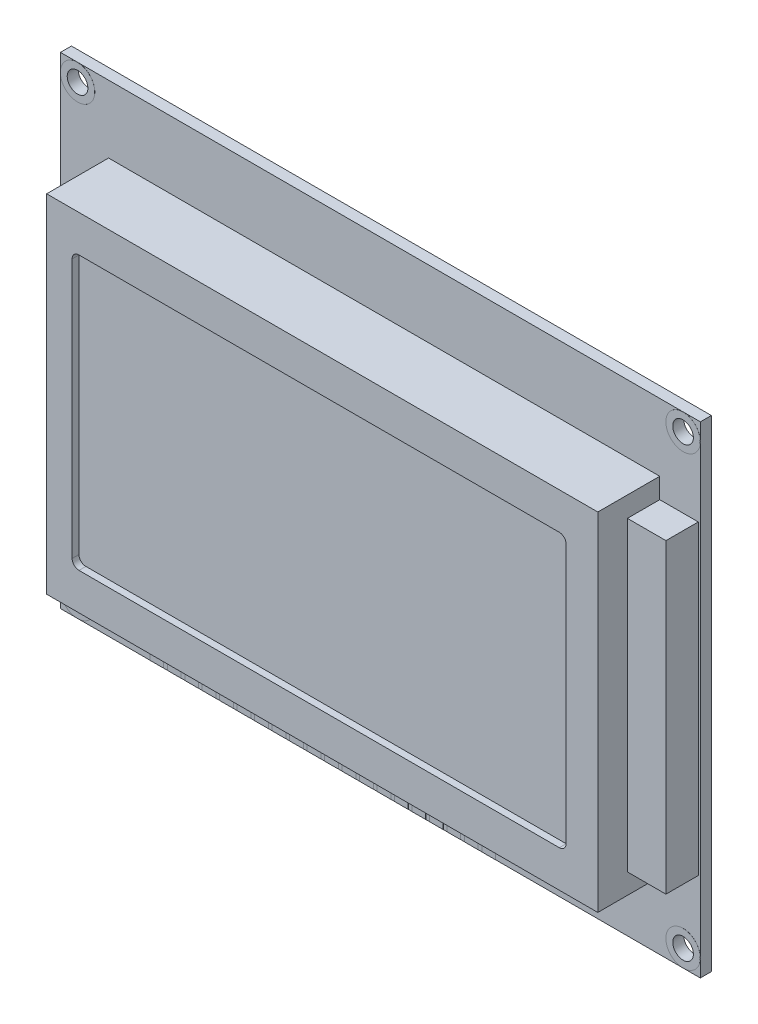
from build123d import *

# Parameters (mm, degrees)
SKETCH1_W          = 93
SKETCH1_H          = 70
BASE_PCB_DEPTH     = 1.6
SKETCH2_R          = 1.5
MOUNT_HOLE_DEPTH   = 59.222074851
SKETCH3_R          = 0.5
PIN_DEPTH          = 59.222074851
GILD_START         = 0.01
SKETCH4_R          = 0.5
SKETCH4_R_2        = 2.5
SKETCH4_R_3        = 1.5
GILD_DEPTH         = 0.01
SKETCH5_W          = 80.1
SKETCH5_H          = 50.4
METAL_SHIELD_DEPTH = 9
GLASS_DEPTH        = 1
SKETCH9_W          = 5.6
SKETCH9_H          = 44.5
BACKLIGHT_DEPTH    = 4.7
SHIELD_CLIP_DEPTH  = 2.6
LPATTERN1_COUNT    = 4
LPATTERN1_PITCH    = 22
SKETCH8_R          = 7
SKETCH8_R_2        = 7.366245051
SKETCH8_R_3        = 7.745103812
IC_DEPTH           = 2
IC_FILLET_R        = 10.5


with BuildPart() as part:
    # Sketch1 → base pcb (new body)
    with BuildSketch(Plane.XY):
        Rectangle(SKETCH1_W, SKETCH1_H)
    extrude(amount=BASE_PCB_DEPTH)

    # Sketch2 → mount hole (cut, through all)
    with BuildSketch(Plane.XY.offset(1.6)):
        with Locations((-44, 32.5)):
            Circle(SKETCH2_R)
        with Locations((-44, -32.5)):
            Circle(SKETCH2_R)
        with Locations((44, -32.5)):
            Circle(SKETCH2_R)
        with Locations((44, 32.5)):
            Circle(SKETCH2_R)
    extrude(amount=-MOUNT_HOLE_DEPTH, mode=Mode.SUBTRACT)

    # Sketch3 → pin (cut, through all)
    with BuildSketch(Plane.XY.offset(1.6)):
        with Locations((-32.5, -32.5)):
            Circle(SKETCH3_R)
        with Locations((-29.96, -32.5)):
            Circle(SKETCH3_R)
        with Locations((-27.42, -32.5)):
            Circle(SKETCH3_R)
        with Locations((-24.88, -32.5)):
            Circle(SKETCH3_R)
        with Locations((-22.34, -32.5)):
            Circle(SKETCH3_R)
        with Locations((-19.8, -32.5)):
            Circle(SKETCH3_R)
        with Locations((-17.26, -32.5)):
            Circle(SKETCH3_R)
        with Locations((-14.72, -32.5)):
            Circle(SKETCH3_R)
        with Locations((-12.18, -32.5)):
            Circle(SKETCH3_R)
        with Locations((-9.64, -32.5)):
            Circle(SKETCH3_R)
        with Locations((-7.1, -32.5)):
            Circle(SKETCH3_R)
        with Locations((-4.56, -32.5)):
            Circle(SKETCH3_R)
        with Locations((-2.02, -32.5)):
            Circle(SKETCH3_R)
        with Locations((0.52, -32.5)):
            Circle(SKETCH3_R)
        with Locations((3.06, -32.5)):
            Circle(SKETCH3_R)
        with Locations((5.6, -32.5)):
            Circle(SKETCH3_R)
        with Locations((8.14, -32.5)):
            Circle(SKETCH3_R)
        with Locations((10.68, -32.5)):
            Circle(SKETCH3_R)
        with Locations((13.22, -32.5)):
            Circle(SKETCH3_R)
        with Locations((15.76, -32.5)):
            Circle(SKETCH3_R)
    extrude(amount=-PIN_DEPTH, mode=Mode.SUBTRACT)

    # Sketch4 → gild (add)
    # profile 1 of 24: a face of its own
    with BuildSketch(Plane.XY.offset(1.6).offset(GILD_START)):
        with BuildLine():
            ThreePointArc((-31.5, -32.5), (-32.5, -31.5), (-33.5, -32.5))
            Line((-33.5, -32.5), (-33.5, -35))
            Line((-33.5, -35), (-31.5, -35))
            Line((-31.5, -35), (-31.5, -32.5))
        make_face()
        with Locations((-32.5, -32.5)):
            Circle(SKETCH4_R, mode=Mode.SUBTRACT)
    # profile 2 of 24: a face of its own
    with BuildSketch(Plane.XY.offset(1.6).offset(GILD_START)):
        with Locations(Location((-44, -32.5, 0), (0, 0, 180))):
            Circle(SKETCH4_R_2)
        with Locations((-44, -32.5)):
            Circle(SKETCH4_R_3, mode=Mode.SUBTRACT)
    # profile 3 of 24: a face of its own
    with BuildSketch(Plane.XY.offset(1.6).offset(GILD_START)):
        with BuildLine():
            Line((-30.96, -32.5), (-30.96, -35))
            Line((-30.96, -35), (-28.96, -35))
            Line((-28.96, -35), (-28.96, -32.5))
            ThreePointArc((-28.96, -32.5), (-29.96, -31.5), (-30.96, -32.5))
        make_face()
        with Locations((-29.96, -32.5)):
            Circle(SKETCH4_R, mode=Mode.SUBTRACT)
    # profile 4 of 24: a face of its own
    with BuildSketch(Plane.XY.offset(1.6).offset(GILD_START)):
        with Locations(Location((-44, 32.5, 0), (0, 0, 180))):
            Circle(SKETCH4_R_2)
        with Locations((-44, 32.5)):
            Circle(SKETCH4_R_3, mode=Mode.SUBTRACT)
    # profile 5 of 24: a face of its own
    with BuildSketch(Plane.XY.offset(1.6).offset(GILD_START)):
        with BuildLine():
            Line((-28.42, -32.5), (-28.42, -35))
            Line((-28.42, -35), (-26.42, -35))
            Line((-26.42, -35), (-26.42, -32.5))
            ThreePointArc((-26.42, -32.5), (-27.42, -31.5), (-28.42, -32.5))
        make_face()
        with Locations((-27.42, -32.5)):
            Circle(SKETCH4_R, mode=Mode.SUBTRACT)
    # profile 6 of 24: a face of its own
    with BuildSketch(Plane.XY.offset(1.6).offset(GILD_START)):
        with Locations((44, 32.5)):
            Circle(SKETCH4_R_2)
        with Locations((44, 32.5)):
            Circle(SKETCH4_R_3, mode=Mode.SUBTRACT)
    # profile 7 of 24: a face of its own
    with BuildSketch(Plane.XY.offset(1.6).offset(GILD_START)):
        with BuildLine():
            Line((-25.88, -32.5), (-25.88, -35))
            Line((-25.88, -35), (-23.88, -35))
            Line((-23.88, -35), (-23.88, -32.5))
            ThreePointArc((-23.88, -32.5), (-24.88, -31.5), (-25.88, -32.5))
        make_face()
        with Locations((-24.88, -32.5)):
            Circle(SKETCH4_R, mode=Mode.SUBTRACT)
    # profile 8 of 24: a face of its own
    with BuildSketch(Plane.XY.offset(1.6).offset(GILD_START)):
        with Locations((44, -32.5)):
            Circle(SKETCH4_R_2)
        with Locations((44, -32.5)):
            Circle(SKETCH4_R_3, mode=Mode.SUBTRACT)
    # profile 9 of 24: a face of its own
    with BuildSketch(Plane.XY.offset(1.6).offset(GILD_START)):
        with BuildLine():
            Line((-23.34, -32.5), (-23.34, -35))
            Line((-23.34, -35), (-21.34, -35))
            Line((-21.34, -35), (-21.34, -32.5))
            ThreePointArc((-21.34, -32.5), (-22.34, -31.5), (-23.34, -32.5))
        make_face()
        with Locations((-22.34, -32.5)):
            Circle(SKETCH4_R, mode=Mode.SUBTRACT)
    # profile 10 of 24: a face of its own
    with BuildSketch(Plane.XY.offset(1.6).offset(GILD_START)):
        with BuildLine():
            Line((14.76, -35), (16.76, -35))
            Line((16.76, -35), (16.76, -32.5))
            ThreePointArc((16.76, -32.5), (15.76, -31.5), (14.76, -32.5))
            Line((14.76, -32.5), (14.76, -35))
        make_face()
        with Locations((15.76, -32.5)):
            Circle(SKETCH4_R, mode=Mode.SUBTRACT)
    # profile 11 of 24: a face of its own
    with BuildSketch(Plane.XY.offset(1.6).offset(GILD_START)):
        with BuildLine():
            Line((-20.8, -32.5), (-20.8, -35))
            Line((-20.8, -35), (-18.8, -35))
            Line((-18.8, -35), (-18.8, -32.5))
            ThreePointArc((-18.8, -32.5), (-19.8, -31.5), (-20.8, -32.5))
        make_face()
        with Locations((-19.8, -32.5)):
            Circle(SKETCH4_R, mode=Mode.SUBTRACT)
    # profile 12 of 24: a face of its own
    with BuildSketch(Plane.XY.offset(1.6).offset(GILD_START)):
        with BuildLine():
            Line((12.22, -35), (14.22, -35))
            Line((14.22, -35), (14.22, -32.5))
            ThreePointArc((14.22, -32.5), (13.22, -31.5), (12.22, -32.5))
            Line((12.22, -32.5), (12.22, -35))
        make_face()
        with Locations((13.22, -32.5)):
            Circle(SKETCH4_R, mode=Mode.SUBTRACT)
    # profile 13 of 24: a face of its own
    with BuildSketch(Plane.XY.offset(1.6).offset(GILD_START)):
        with BuildLine():
            Line((-18.26, -32.5), (-18.26, -35))
            Line((-18.26, -35), (-16.26, -35))
            Line((-16.26, -35), (-16.26, -32.5))
            ThreePointArc((-16.26, -32.5), (-17.26, -31.5), (-18.26, -32.5))
        make_face()
        with Locations((-17.26, -32.5)):
            Circle(SKETCH4_R, mode=Mode.SUBTRACT)
    # profile 14 of 24: a face of its own
    with BuildSketch(Plane.XY.offset(1.6).offset(GILD_START)):
        with BuildLine():
            Line((9.68, -35), (11.68, -35))
            Line((11.68, -35), (11.68, -32.5))
            ThreePointArc((11.68, -32.5), (10.68, -31.5), (9.68, -32.5))
            Line((9.68, -32.5), (9.68, -35))
        make_face()
        with Locations((10.68, -32.5)):
            Circle(SKETCH4_R, mode=Mode.SUBTRACT)
    # profile 15 of 24: a face of its own
    with BuildSketch(Plane.XY.offset(1.6).offset(GILD_START)):
        with BuildLine():
            Line((-15.72, -32.5), (-15.72, -35))
            Line((-15.72, -35), (-13.72, -35))
            Line((-13.72, -35), (-13.72, -32.5))
            ThreePointArc((-13.72, -32.5), (-14.72, -31.5), (-15.72, -32.5))
        make_face()
        with Locations((-14.72, -32.5)):
            Circle(SKETCH4_R, mode=Mode.SUBTRACT)
    # profile 16 of 24: a face of its own
    with BuildSketch(Plane.XY.offset(1.6).offset(GILD_START)):
        with BuildLine():
            Line((7.14, -35), (9.14, -35))
            Line((9.14, -35), (9.14, -32.5))
            ThreePointArc((9.14, -32.5), (8.14, -31.5), (7.14, -32.5))
            Line((7.14, -32.5), (7.14, -35))
        make_face()
        with Locations((8.14, -32.5)):
            Circle(SKETCH4_R, mode=Mode.SUBTRACT)
    # profile 17 of 24: a face of its own
    with BuildSketch(Plane.XY.offset(1.6).offset(GILD_START)):
        with BuildLine():
            Line((-13.18, -32.5), (-13.18, -35))
            Line((-13.18, -35), (-11.18, -35))
            Line((-11.18, -35), (-11.18, -32.5))
            ThreePointArc((-11.18, -32.5), (-12.18, -31.5), (-13.18, -32.5))
        make_face()
        with Locations((-12.18, -32.5)):
            Circle(SKETCH4_R, mode=Mode.SUBTRACT)
    # profile 18 of 24: a face of its own
    with BuildSketch(Plane.XY.offset(1.6).offset(GILD_START)):
        with BuildLine():
            Line((4.6, -35), (6.6, -35))
            Line((6.6, -35), (6.6, -32.5))
            ThreePointArc((6.6, -32.5), (5.6, -31.5), (4.6, -32.5))
            Line((4.6, -32.5), (4.6, -35))
        make_face()
        with Locations((5.6, -32.5)):
            Circle(SKETCH4_R, mode=Mode.SUBTRACT)
    # profile 19 of 24: a face of its own
    with BuildSketch(Plane.XY.offset(1.6).offset(GILD_START)):
        with BuildLine():
            Line((-10.64, -32.5), (-10.64, -35))
            Line((-10.64, -35), (-8.64, -35))
            Line((-8.64, -35), (-8.64, -32.5))
            ThreePointArc((-8.64, -32.5), (-9.64, -31.5), (-10.64, -32.5))
        make_face()
        with Locations((-9.64, -32.5)):
            Circle(SKETCH4_R, mode=Mode.SUBTRACT)
    # profile 20 of 24: a face of its own
    with BuildSketch(Plane.XY.offset(1.6).offset(GILD_START)):
        with BuildLine():
            Line((2.06, -35), (4.06, -35))
            Line((4.06, -35), (4.06, -32.5))
            ThreePointArc((4.06, -32.5), (3.06, -31.5), (2.06, -32.5))
            Line((2.06, -32.5), (2.06, -35))
        make_face()
        with Locations((3.06, -32.5)):
            Circle(SKETCH4_R, mode=Mode.SUBTRACT)
    # profile 21 of 24: a face of its own
    with BuildSketch(Plane.XY.offset(1.6).offset(GILD_START)):
        with BuildLine():
            Line((-8.1, -32.5), (-8.1, -35))
            Line((-8.1, -35), (-6.1, -35))
            Line((-6.1, -35), (-6.1, -32.5))
            ThreePointArc((-6.1, -32.5), (-7.1, -31.5), (-8.1, -32.5))
        make_face()
        with Locations((-7.1, -32.5)):
            Circle(SKETCH4_R, mode=Mode.SUBTRACT)
    # profile 22 of 24: a face of its own
    with BuildSketch(Plane.XY.offset(1.6).offset(GILD_START)):
        with BuildLine():
            Line((-0.48, -35), (1.52, -35))
            Line((1.52, -35), (1.52, -32.5))
            ThreePointArc((1.52, -32.5), (0.52, -31.5), (-0.48, -32.5))
            Line((-0.48, -32.5), (-0.48, -35))
        make_face()
        with Locations((0.52, -32.5)):
            Circle(SKETCH4_R, mode=Mode.SUBTRACT)
    # profile 23 of 24: a face of its own
    with BuildSketch(Plane.XY.offset(1.6).offset(GILD_START)):
        with BuildLine():
            Line((-5.56, -32.5), (-5.56, -35))
            Line((-5.56, -35), (-3.56, -35))
            Line((-3.56, -35), (-3.56, -32.5))
            ThreePointArc((-3.56, -32.5), (-4.56, -31.5), (-5.56, -32.5))
        make_face()
        with Locations((-4.56, -32.5)):
            Circle(SKETCH4_R, mode=Mode.SUBTRACT)
    # profile 24 of 24: a face of its own
    with BuildSketch(Plane.XY.offset(1.6).offset(GILD_START)):
        with BuildLine():
            Line((-3.02, -35), (-1.02, -35))
            Line((-1.02, -35), (-1.02, -32.5))
            ThreePointArc((-1.02, -32.5), (-2.02, -31.5), (-3.02, -32.5))
            Line((-3.02, -32.5), (-3.02, -35))
        make_face()
        with Locations((-2.02, -32.5)):
            Circle(SKETCH4_R, mode=Mode.SUBTRACT)
    extrude(amount=-GILD_DEPTH)

    # Sketch5 → metal shield (add)
    with BuildSketch(Plane.XY.offset(1.6)):
        with Locations((0.55, 0)):
            Rectangle(SKETCH5_W, SKETCH5_H)
    extrude(amount=METAL_SHIELD_DEPTH)

    # Sketch6 → glass (cut)
    with BuildSketch(Plane.XY.offset(10.6)):
        with BuildLine():
            Line((-34.8, 19.85), (35, 19.85))
            ThreePointArc((35, 19.85), (35.707106781, 19.557106781), (36, 18.85))
            Line((36, 18.85), (36, -18.85))
            ThreePointArc((36, -18.85), (35.707106781, -19.557106781), (35, -19.85))
            Line((35, -19.85), (-34.8, -19.85))
            ThreePointArc((-34.8, -19.85), (-35.507106781, -19.557106781), (-35.8, -18.85))
            Line((-35.8, -18.85), (-35.8, 18.85))
            ThreePointArc((-35.8, 18.85), (-35.507106781, 19.557106781), (-34.8, 19.85))
        make_face()
    extrude(amount=-GLASS_DEPTH, mode=Mode.SUBTRACT)

    # Sketch9 → backlight (add)
    with BuildSketch(Plane.XY.offset(1.6)):
        with Locations((43.4, 0)):
            Rectangle(SKETCH9_W, SKETCH9_H)
    extrude(amount=BACKLIGHT_DEPTH)

    # Sketch7 → shield_clip (add)
    with BuildSketch(Plane(origin=(0, 0, 0), x_dir=(-1, 0, 0), z_dir=(0, 0, -1))):
        Polygon((-36.062466814, 25.171713449), (-32.114701008, 21.730902286), (-31.55553681, 22.372451385), (-35.503302616, 25.813262548), align=None)
    shield_clip = extrude(amount=SHIELD_CLIP_DEPTH)

    # LPattern1: shield_clip ×4
    with Locations(*[(-i * LPATTERN1_PITCH, 0, 0) for i in range(1, LPATTERN1_COUNT)]):
        add(shield_clip)

    # Sketch8 → IC (add)
    with BuildSketch(Plane(origin=(0, 0, 0), x_dir=(-1, 0, 0), z_dir=(0, 0, -1))):
        with Locations(Location((-16.516806041, 2.638980249, 0), (0, 0, 180))):
            Circle(SKETCH8_R)
        with Locations(Location((5.261461487, 4.245604471, 0), (0, 0, 180))):
            Circle(SKETCH8_R_2)
        with Locations(Location((26.00679982, 1.064566419, 0), (0, 0, 180))):
            Circle(SKETCH8_R_3)
    extrude(amount=IC_DEPTH)

    # IC fillet
    # the kernel refuses this fillet: 10.5 mm, written as the material it takes off along each edge
    with BuildSketch(Plane(origin=(16.516806041, 2.638980249, -2), x_dir=(1, 0, 0), z_dir=(0, 1, 0))) as ic_fillet_piece_1:
        with BuildLine():
            CenterArc((0.835585997, -10.5), IC_FILLET_R, 54.04943238, 35.95056762)
            Line((0.835585997, 0), (0.835585997, 0.21))
            Line((0.835585997, 0.21), (7, 0.21))
            Line((7, 0.21), (7.21, 0))
            ThreePointArc((7.21, 0), (7.21, -1), (7.12328828, -1.83))
            Line((7.12328828, -1.83), (7, -2))
        make_face()
    revolve(axis=Axis((16.516806041, 2.638980249, -2), (0, 0, -1)), mode=Mode.SUBTRACT)
    with BuildSketch(Plane(origin=(-5.261461487, 4.245604471, -2), x_dir=(1, 0, 0), z_dir=(0, 1, 0))) as ic_fillet_piece_2:
        with BuildLine():
            CenterArc((1.201831048, -10.5), IC_FILLET_R, 54.04943238, 35.95056762)
            Line((1.201831048, 0), (1.201831048, 0.21))
            Line((1.201831048, 0.21), (7.366245051, 0.21))
            Line((7.366245051, 0.21), (7.576245051, 0))
            ThreePointArc((7.576245051, 0), (7.576245051, -1), (7.489533331, -1.83))
            Line((7.489533331, -1.83), (7.366245051, -2))
        make_face()
    revolve(axis=Axis((-5.261461487, 4.245604471, -2), (0, 0, -1)), mode=Mode.SUBTRACT)
    with BuildSketch(Plane(origin=(-26.00679982, 1.064566419, -2), x_dir=(1, 0, 0), z_dir=(0, 1, 0))) as ic_fillet_piece_3:
        with BuildLine():
            CenterArc((1.580689809, -10.5), IC_FILLET_R, 54.04943238, 35.95056762)
            Line((1.580689809, 0), (1.580689809, 0.21))
            Line((1.580689809, 0.21), (7.745103812, 0.21))
            Line((7.745103812, 0.21), (7.955103812, 0))
            ThreePointArc((7.955103812, 0), (7.955103812, -1), (7.868392092, -1.83))
            Line((7.868392092, -1.83), (7.745103812, -2))
        make_face()
    revolve(axis=Axis((-26.00679982, 1.064566419, -2), (0, 0, -1)), mode=Mode.SUBTRACT)


solid = part.part
